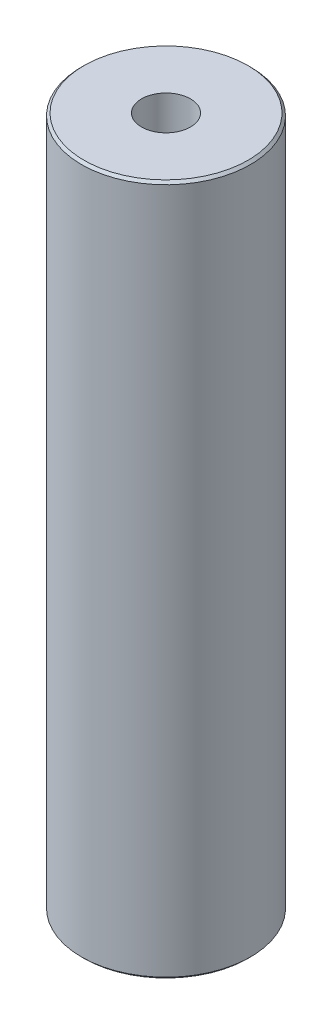
from build123d import *

# Parameters (mm, degrees)
SKETCH1_R           = 27.5
BOSS_EXTRUDE1_DEPTH = 224.896192392
SKETCH2_R           = 7.957193374
CUT_EXTRUDE1_DEPTH  = 229.234084555
CHAMFER1_SIZE       = 0.807405281


with BuildPart() as part:
    # Sketch1 → Boss-Extrude1 (new body)
    with BuildSketch(Plane(origin=(0, 0, 0), x_dir=(1, 0, 0), z_dir=(0, 1, 0))):
        Circle(SKETCH1_R)
    extrude(amount=BOSS_EXTRUDE1_DEPTH)

    # Sketch2 → Cut-Extrude1 (cut, through all)
    with BuildSketch(Plane(origin=(0, 0, 0), x_dir=(1, 0, 0), z_dir=(0, 1, 0))):
        Circle(SKETCH2_R)
    extrude(amount=CUT_EXTRUDE1_DEPTH, mode=Mode.SUBTRACT)

    # Chamfer1
    chamfer1_edges = [part.edges().sort_by_distance(p)[0] for p in [
        (-27.5, 224.896192392, 0),
        (-27.5, 0, 0),
    ]]
    chamfer(chamfer1_edges, length=CHAMFER1_SIZE)


solid = part.part
